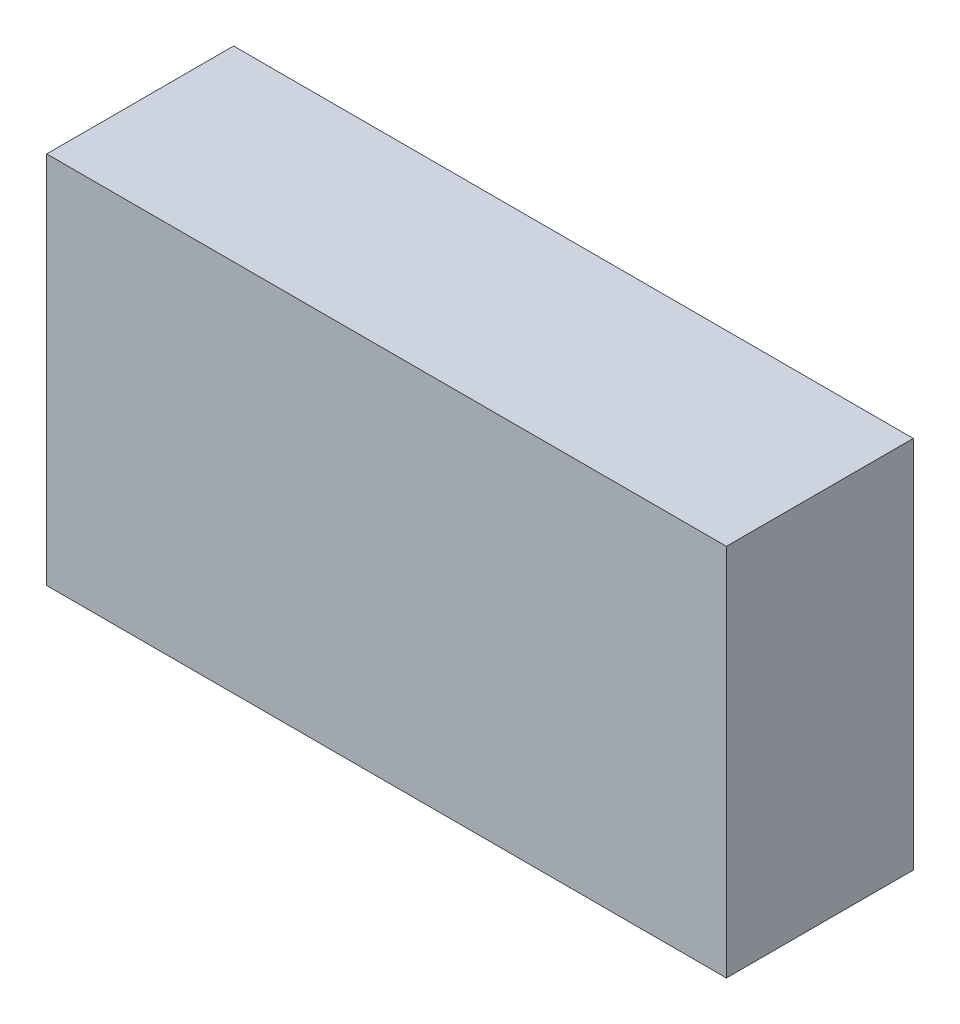
from build123d import *

# Parameters (mm, degrees)
SKETCH1_W           = 40
SKETCH1_H           = 22
BOSS_EXTRUDE1_DEPTH = 11


with BuildPart() as part:
    # Sketch1 → Boss-Extrude1 (new body)
    with BuildSketch(Plane.XY):
        with Locations((23, 16)):
            Rectangle(SKETCH1_W, SKETCH1_H)
    extrude(amount=BOSS_EXTRUDE1_DEPTH)


solid = part.part
